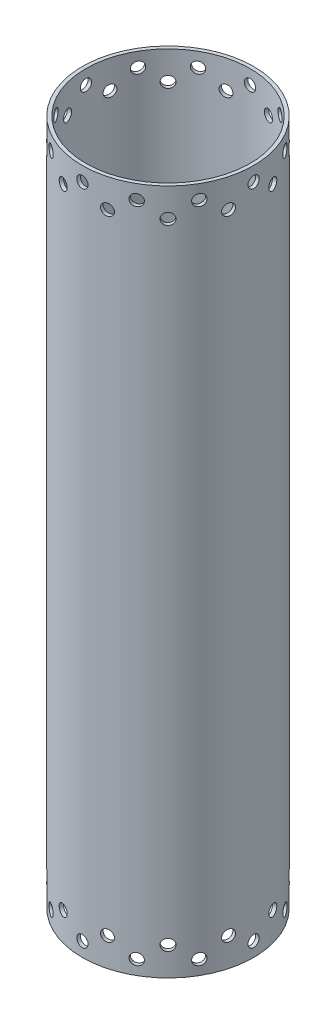
from build123d import *

# Parameters (mm, degrees)
SKETCH2_R                = 76.2
SKETCH2_R_2              = 73.025
BOSS_EXTRUDE1_DEPTH      = 609.6
SKETCH3_R                = 5.0419
CUT_EXTRUDE1_DEPTH       = 1143
SKETCH6_R                = 5.0419
CUT_EXTRUDE2_DEPTH       = 25.4
CIRPATTERN2_COUNT        = 12
MIRROR1_COPY_1_SKETCH_R  = 5.0419
MIRROR1_COPY_1_DEPTH     = 1143
MIRROR1_COPY_2_SKETCH_R  = 5.0419
MIRROR1_COPY_2_DEPTH     = 1143
MIRROR1_COPY_3_SKETCH_R  = 5.0419
MIRROR1_COPY_3_DEPTH     = 1143
MIRROR1_COPY_4_SKETCH_R  = 5.0419
MIRROR1_COPY_4_DEPTH     = 1143
MIRROR1_COPY_5_SKETCH_R  = 5.0419
MIRROR1_COPY_5_DEPTH     = 1143
MIRROR1_COPY_6_SKETCH_R  = 5.0419
MIRROR1_COPY_6_DEPTH     = 1143
MIRROR1_COPY_7_SKETCH_R  = 5.0419
MIRROR1_COPY_7_DEPTH     = 1143
MIRROR1_COPY_8_SKETCH_R  = 5.0419
MIRROR1_COPY_8_DEPTH     = 1143
MIRROR1_COPY_9_SKETCH_R  = 5.0419
MIRROR1_COPY_9_DEPTH     = 1143
MIRROR1_COPY_10_SKETCH_R = 5.0419
MIRROR1_COPY_10_DEPTH    = 1143
MIRROR1_COPY_11_SKETCH_R = 5.0419
MIRROR1_COPY_11_DEPTH    = 1143
MIRROR1_COPY_12_SKETCH_R = 5.0419
MIRROR1_COPY_12_DEPTH    = 25.4
MIRROR1_COPY_13_SKETCH_R = 5.0419
MIRROR1_COPY_13_DEPTH    = 25.4
MIRROR1_COPY_14_SKETCH_R = 5.0419
MIRROR1_COPY_14_DEPTH    = 25.4
MIRROR1_COPY_15_SKETCH_R = 5.0419
MIRROR1_COPY_15_DEPTH    = 25.4
MIRROR1_COPY_16_SKETCH_R = 5.0419
MIRROR1_COPY_16_DEPTH    = 25.4
MIRROR1_COPY_17_SKETCH_R = 5.0419
MIRROR1_COPY_17_DEPTH    = 25.4
MIRROR1_COPY_18_SKETCH_R = 5.0419
MIRROR1_COPY_18_DEPTH    = 25.4
MIRROR1_COPY_19_SKETCH_R = 5.0419
MIRROR1_COPY_19_DEPTH    = 25.4
MIRROR1_COPY_20_SKETCH_R = 5.0419
MIRROR1_COPY_20_DEPTH    = 25.4
MIRROR1_COPY_21_SKETCH_R = 5.0419
MIRROR1_COPY_21_DEPTH    = 25.4
MIRROR1_COPY_22_SKETCH_R = 5.0419
MIRROR1_COPY_22_DEPTH    = 25.4
MIRROR1_COPY_23_SKETCH_R = 5.0419
MIRROR1_COPY_23_DEPTH    = 1143
MIRROR1_COPY_24_SKETCH_R = 5.0419
MIRROR1_COPY_24_DEPTH    = 25.4


with BuildPart() as part:
    # Sketch2 → Boss-Extrude1 (new body)
    with BuildSketch(Plane(origin=(0, 0, 0), x_dir=(1, 0, 0), z_dir=(0, 1, 0))):
        Circle(SKETCH2_R)
        Circle(SKETCH2_R_2, mode=Mode.SUBTRACT)
    extrude(amount=BOSS_EXTRUDE1_DEPTH)

    # Sketch3 → Cut-Extrude1 (cut)
    with BuildSketch(Plane.XY):
        with Locations((0, 596.9)):
            Circle(SKETCH3_R)
    cut_extrude1 = extrude(amount=-CUT_EXTRUDE1_DEPTH, mode=Mode.SUBTRACT)

    # Sketch6 → Cut-Extrude2 (cut)
    with BuildSketch(Plane(origin=(-19.722011237, 0, 73.603547963), x_dir=(0, -1, 0), z_dir=(-0.25881904510252135, 0, 0.9659258262890681))):
        with Locations((-584.2, 0)):
            Circle(SKETCH6_R)
    cut_extrude2 = extrude(amount=-CUT_EXTRUDE2_DEPTH, mode=Mode.SUBTRACT)

    # CirPattern2: Cut-Extrude1, Cut-Extrude2 ×12 about axis
    cirpattern2_axis = Axis((0, 609.6, 0), (0, -1, 0))
    add([cut_extrude1.rotate(cirpattern2_axis, i * 360 / CIRPATTERN2_COUNT) for i in range(1, CIRPATTERN2_COUNT)], mode=Mode.SUBTRACT)
    add([cut_extrude2.rotate(cirpattern2_axis, i * 360 / CIRPATTERN2_COUNT) for i in range(1, CIRPATTERN2_COUNT)], mode=Mode.SUBTRACT)

    # Mirror1 copy 1 sketch → Mirror1 copy 1 (cut)
    with BuildSketch(Plane(origin=(0, 609.6, 0), x_dir=(0.8660254037844387, 0, 0.49999999999999994), z_dir=(-0.49999999999999994, 0, 0.8660254037844387))):
        with Locations((0, -596.9)):
            Circle(MIRROR1_COPY_1_SKETCH_R)
    extrude(amount=-MIRROR1_COPY_1_DEPTH, mode=Mode.SUBTRACT)

    # Mirror1 copy 2 sketch → Mirror1 copy 2 (cut)
    with BuildSketch(Plane(origin=(0, 609.6, 0), x_dir=(0.5000000000000001, 0, 0.8660254037844386), z_dir=(-0.8660254037844386, 0, 0.5000000000000001))):
        with Locations((0, -596.9)):
            Circle(MIRROR1_COPY_2_SKETCH_R)
    extrude(amount=-MIRROR1_COPY_2_DEPTH, mode=Mode.SUBTRACT)

    # Mirror1 copy 3 sketch → Mirror1 copy 3 (cut)
    with BuildSketch(Plane(origin=(0, 609.6, 0), x_dir=(0, 0, 1), z_dir=(-1, 0, 0))):
        with Locations((0, -596.9)):
            Circle(MIRROR1_COPY_3_SKETCH_R)
    extrude(amount=-MIRROR1_COPY_3_DEPTH, mode=Mode.SUBTRACT)

    # Mirror1 copy 4 sketch → Mirror1 copy 4 (cut)
    with BuildSketch(Plane(origin=(0, 609.6, 0), x_dir=(-0.4999999999999998, 0, 0.8660254037844387), z_dir=(-0.8660254037844387, 0, -0.4999999999999998))):
        with Locations((0, -596.9)):
            Circle(MIRROR1_COPY_4_SKETCH_R)
    extrude(amount=-MIRROR1_COPY_4_DEPTH, mode=Mode.SUBTRACT)

    # Mirror1 copy 5 sketch → Mirror1 copy 5 (cut)
    with BuildSketch(Plane(origin=(0, 609.6, 0), x_dir=(-0.8660254037844387, 0, 0.49999999999999994), z_dir=(-0.49999999999999994, 0, -0.8660254037844387))):
        with Locations((0, -596.9)):
            Circle(MIRROR1_COPY_5_SKETCH_R)
    extrude(amount=-MIRROR1_COPY_5_DEPTH, mode=Mode.SUBTRACT)

    # Mirror1 copy 6 sketch → Mirror1 copy 6 (cut)
    with BuildSketch(Plane(origin=(0, 609.6, 0), x_dir=(-1, 0, 0), z_dir=(0, 0, -1))):
        with Locations((0, -596.9)):
            Circle(MIRROR1_COPY_6_SKETCH_R)
    extrude(amount=-MIRROR1_COPY_6_DEPTH, mode=Mode.SUBTRACT)

    # Mirror1 copy 7 sketch → Mirror1 copy 7 (cut)
    with BuildSketch(Plane(origin=(0, 609.6, 0), x_dir=(-0.8660254037844386, 0, -0.5000000000000001), z_dir=(0.5000000000000001, 0, -0.8660254037844386))):
        with Locations((0, -596.9)):
            Circle(MIRROR1_COPY_7_SKETCH_R)
    extrude(amount=-MIRROR1_COPY_7_DEPTH, mode=Mode.SUBTRACT)

    # Mirror1 copy 8 sketch → Mirror1 copy 8 (cut)
    with BuildSketch(Plane(origin=(0, 609.6, 0), x_dir=(-0.5000000000000004, 0, -0.8660254037844384), z_dir=(0.8660254037844384, 0, -0.5000000000000004))):
        with Locations((0, -596.9)):
            Circle(MIRROR1_COPY_8_SKETCH_R)
    extrude(amount=-MIRROR1_COPY_8_DEPTH, mode=Mode.SUBTRACT)

    # Mirror1 copy 9 sketch → Mirror1 copy 9 (cut)
    with BuildSketch(Plane(origin=(0, 609.6, 0), x_dir=(0, 0, -1), z_dir=(1, 0, 0))):
        with Locations((0, -596.9)):
            Circle(MIRROR1_COPY_9_SKETCH_R)
    extrude(amount=-MIRROR1_COPY_9_DEPTH, mode=Mode.SUBTRACT)

    # Mirror1 copy 10 sketch → Mirror1 copy 10 (cut)
    with BuildSketch(Plane(origin=(0, 609.6, 0), x_dir=(0.5000000000000001, 0, -0.8660254037844386), z_dir=(0.8660254037844386, 0, 0.5000000000000001))):
        with Locations((0, -596.9)):
            Circle(MIRROR1_COPY_10_SKETCH_R)
    extrude(amount=-MIRROR1_COPY_10_DEPTH, mode=Mode.SUBTRACT)

    # Mirror1 copy 11 sketch → Mirror1 copy 11 (cut)
    with BuildSketch(Plane(origin=(0, 609.6, 0), x_dir=(0.8660254037844384, 0, -0.5000000000000004), z_dir=(0.5000000000000004, 0, 0.8660254037844384))):
        with Locations((0, -596.9)):
            Circle(MIRROR1_COPY_11_SKETCH_R)
    extrude(amount=-MIRROR1_COPY_11_DEPTH, mode=Mode.SUBTRACT)

    # Mirror1 copy 12 sketch → Mirror1 copy 12 (cut)
    with BuildSketch(Plane(origin=(-53.881536726, 609.6, 53.881536726), x_dir=(0, 1, 0), z_dir=(-0.7071067811865479, 0, 0.7071067811865472))):
        with Locations((-584.2, 0)):
            Circle(MIRROR1_COPY_12_SKETCH_R)
    extrude(amount=-MIRROR1_COPY_12_DEPTH, mode=Mode.SUBTRACT)

    # Mirror1 copy 13 sketch → Mirror1 copy 13 (cut)
    with BuildSketch(Plane(origin=(-73.603547963, 609.6, 19.722011237), x_dir=(0, 1, 0), z_dir=(-0.9659258262890684, 0, 0.2588190451025203))):
        with Locations((-584.2, 0)):
            Circle(MIRROR1_COPY_13_SKETCH_R)
    extrude(amount=-MIRROR1_COPY_13_DEPTH, mode=Mode.SUBTRACT)

    # Mirror1 copy 14 sketch → Mirror1 copy 14 (cut)
    with BuildSketch(Plane(origin=(-73.603547963, 609.6, -19.722011237), x_dir=(0, 1, 0), z_dir=(-0.9659258262890681, 0, -0.2588190451025213))):
        with Locations((-584.2, 0)):
            Circle(MIRROR1_COPY_14_SKETCH_R)
    extrude(amount=-MIRROR1_COPY_14_DEPTH, mode=Mode.SUBTRACT)

    # Mirror1 copy 15 sketch → Mirror1 copy 15 (cut)
    with BuildSketch(Plane(origin=(-53.881536726, 609.6, -53.881536726), x_dir=(0, 1, 0), z_dir=(-0.7071067811865472, 0, -0.7071067811865477))):
        with Locations((-584.2, 0)):
            Circle(MIRROR1_COPY_15_SKETCH_R)
    extrude(amount=-MIRROR1_COPY_15_DEPTH, mode=Mode.SUBTRACT)

    # Mirror1 copy 16 sketch → Mirror1 copy 16 (cut)
    with BuildSketch(Plane(origin=(-19.722011237, 609.6, -73.603547963), x_dir=(0, 1, 0), z_dir=(-0.2588190451025201, 0, -0.9659258262890684))):
        with Locations((-584.2, 0)):
            Circle(MIRROR1_COPY_16_SKETCH_R)
    extrude(amount=-MIRROR1_COPY_16_DEPTH, mode=Mode.SUBTRACT)

    # Mirror1 copy 17 sketch → Mirror1 copy 17 (cut)
    with BuildSketch(Plane(origin=(19.722011237, 609.6, -73.603547963), x_dir=(0, 1, 0), z_dir=(0.25881904510252124, 0, -0.9659258262890681))):
        with Locations((-584.2, 0)):
            Circle(MIRROR1_COPY_17_SKETCH_R)
    extrude(amount=-MIRROR1_COPY_17_DEPTH, mode=Mode.SUBTRACT)

    # Mirror1 copy 18 sketch → Mirror1 copy 18 (cut)
    with BuildSketch(Plane(origin=(53.881536726, 609.6, -53.881536726), x_dir=(0, 1, 0), z_dir=(0.707106781186548, 0, -0.707106781186547))):
        with Locations((-584.2, 0)):
            Circle(MIRROR1_COPY_18_SKETCH_R)
    extrude(amount=-MIRROR1_COPY_18_DEPTH, mode=Mode.SUBTRACT)

    # Mirror1 copy 19 sketch → Mirror1 copy 19 (cut)
    with BuildSketch(Plane(origin=(73.603547963, 609.6, -19.722011237), x_dir=(0, 1, 0), z_dir=(0.9659258262890683, 0, -0.25881904510252063))):
        with Locations((-584.2, 0)):
            Circle(MIRROR1_COPY_19_SKETCH_R)
    extrude(amount=-MIRROR1_COPY_19_DEPTH, mode=Mode.SUBTRACT)

    # Mirror1 copy 20 sketch → Mirror1 copy 20 (cut)
    with BuildSketch(Plane(origin=(73.603547963, 609.6, 19.722011237), x_dir=(0, 1, 0), z_dir=(0.9659258262890681, 0, 0.2588190451025212))):
        with Locations((-584.2, 0)):
            Circle(MIRROR1_COPY_20_SKETCH_R)
    extrude(amount=-MIRROR1_COPY_20_DEPTH, mode=Mode.SUBTRACT)

    # Mirror1 copy 21 sketch → Mirror1 copy 21 (cut)
    with BuildSketch(Plane(origin=(53.881536726, 609.6, 53.881536726), x_dir=(0, 1, 0), z_dir=(0.707106781186547, 0, 0.707106781186548))):
        with Locations((-584.2, 0)):
            Circle(MIRROR1_COPY_21_SKETCH_R)
    extrude(amount=-MIRROR1_COPY_21_DEPTH, mode=Mode.SUBTRACT)

    # Mirror1 copy 22 sketch → Mirror1 copy 22 (cut)
    with BuildSketch(Plane(origin=(19.722011237, 609.6, 73.603547963), x_dir=(0, 1, 0), z_dir=(0.25881904510252063, 0, 0.9659258262890683))):
        with Locations((-584.2, 0)):
            Circle(MIRROR1_COPY_22_SKETCH_R)
    extrude(amount=-MIRROR1_COPY_22_DEPTH, mode=Mode.SUBTRACT)

    # Mirror1 copy 23 sketch → Mirror1 copy 23 (cut)
    with BuildSketch(Plane(origin=(0, 609.6, 0), x_dir=(1, 0, 0), z_dir=(0, 0, 1))):
        with Locations((0, -596.9)):
            Circle(MIRROR1_COPY_23_SKETCH_R)
    extrude(amount=-MIRROR1_COPY_23_DEPTH, mode=Mode.SUBTRACT)

    # Mirror1 copy 24 sketch → Mirror1 copy 24 (cut)
    with BuildSketch(Plane(origin=(-19.722011237, 609.6, 73.603547963), x_dir=(0, 1, 0), z_dir=(-0.25881904510252135, 0, 0.9659258262890681))):
        with Locations((-584.2, 0)):
            Circle(MIRROR1_COPY_24_SKETCH_R)
    extrude(amount=-MIRROR1_COPY_24_DEPTH, mode=Mode.SUBTRACT)


solid = part.part
